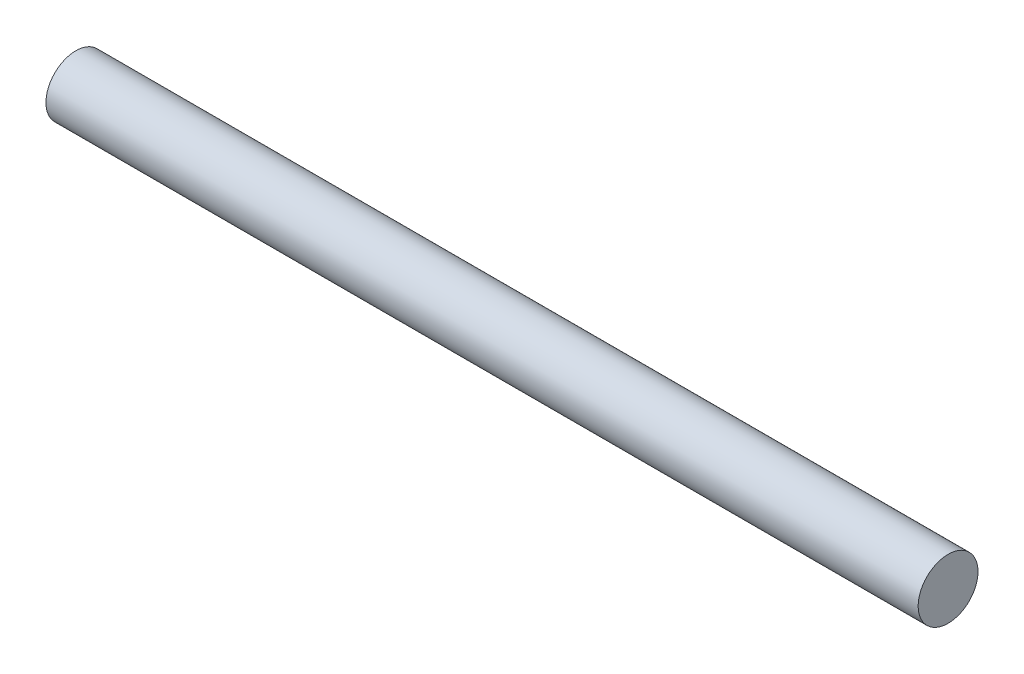
from build123d import *

# Parameters (mm, degrees)
SKETCH1_R           = 2.4
BOSS_EXTRUDE1_DEPTH = 35


with BuildPart() as part:
    # Sketch1 → Boss-Extrude1 (new, symmetric)
    with BuildSketch(Plane(origin=(0, 0, 0), x_dir=(0, 0, -1), z_dir=(1, 0, 0))):
        Circle(SKETCH1_R)
    extrude(amount=BOSS_EXTRUDE1_DEPTH, both=True)


solid = part.part
